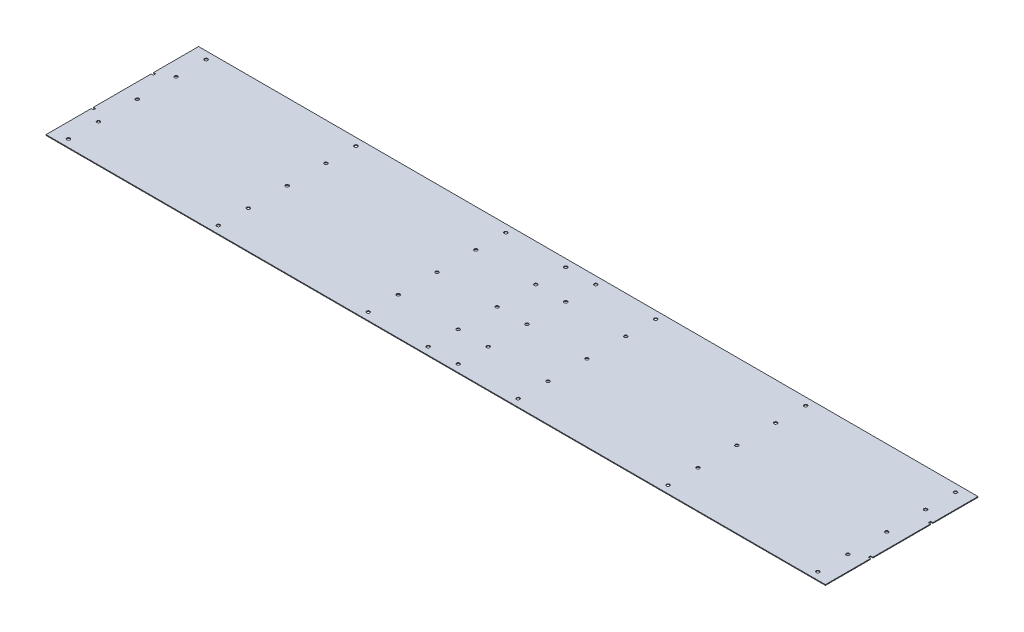
from build123d import *

# Parameters (mm, degrees)
SKETCH1_R           = 2.15
BOSS_EXTRUDE1_DEPTH = 1


with BuildPart() as part:
    # Sketch1 → Boss-Extrude1 (new body)
    with BuildSketch(Plane(origin=(0, 0, 0), x_dir=(1, 0, 0), z_dir=(0, 1, 0))):
        Polygon((-17, -41.5), (-20, -41.5), (-20, -101.8), (1020, -101.8), (1020, -41.5), (1017, -41.5), (1017, -38.5), (1020, -38.5), (1020, 38.5), (1017, 38.5), (1017, 41.5), (1020, 41.5), (1020, 101.8), (-20, 101.8), (-20, 41.5), (-17, 41.5), (-17, 38.5), (-20, 38.5), (-20, -38.5), (-17, -38.5), align=None)
        with Locations((0, -91.8)):
            Circle(SKETCH1_R, mode=Mode.SUBTRACT)
        with Locations((200, -91.8)):
            Circle(SKETCH1_R, mode=Mode.SUBTRACT)
        with Locations((0, -51.8)):
            Circle(SKETCH1_R, mode=Mode.SUBTRACT)
        with Locations((200, -51.8)):
            Circle(SKETCH1_R, mode=Mode.SUBTRACT)
        with Locations((400, -91.8)):
            Circle(SKETCH1_R, mode=Mode.SUBTRACT)
        with Locations((480, -91.8)):
            Circle(SKETCH1_R, mode=Mode.SUBTRACT)
        with Locations((400, -51.8)):
            Circle(SKETCH1_R, mode=Mode.SUBTRACT)
        with Locations((480, -51.8)):
            Circle(SKETCH1_R, mode=Mode.SUBTRACT)
        Circle(SKETCH1_R, mode=Mode.SUBTRACT)
        with Locations((200, 0)):
            Circle(SKETCH1_R, mode=Mode.SUBTRACT)
        with Locations((400, 0)):
            Circle(SKETCH1_R, mode=Mode.SUBTRACT)
        with Locations((480, 0)):
            Circle(SKETCH1_R, mode=Mode.SUBTRACT)
        with Locations((520, -91.8)):
            Circle(SKETCH1_R, mode=Mode.SUBTRACT)
        with Locations((600, -91.8)):
            Circle(SKETCH1_R, mode=Mode.SUBTRACT)
        with Locations((520, -51.8)):
            Circle(SKETCH1_R, mode=Mode.SUBTRACT)
        with Locations((600, -51.8)):
            Circle(SKETCH1_R, mode=Mode.SUBTRACT)
        with Locations((800, -91.8)):
            Circle(SKETCH1_R, mode=Mode.SUBTRACT)
        with Locations((1000, -91.8)):
            Circle(SKETCH1_R, mode=Mode.SUBTRACT)
        with Locations((800, -51.8)):
            Circle(SKETCH1_R, mode=Mode.SUBTRACT)
        with Locations((1000, -51.8)):
            Circle(SKETCH1_R, mode=Mode.SUBTRACT)
        with Locations((520, 0)):
            Circle(SKETCH1_R, mode=Mode.SUBTRACT)
        with Locations((600, 0)):
            Circle(SKETCH1_R, mode=Mode.SUBTRACT)
        with Locations((800, 0)):
            Circle(SKETCH1_R, mode=Mode.SUBTRACT)
        with Locations((1000, 0)):
            Circle(SKETCH1_R, mode=Mode.SUBTRACT)
        with Locations((0, 51.8)):
            Circle(SKETCH1_R, mode=Mode.SUBTRACT)
        with Locations((200, 51.8)):
            Circle(SKETCH1_R, mode=Mode.SUBTRACT)
        with Locations((0, 91.8)):
            Circle(SKETCH1_R, mode=Mode.SUBTRACT)
        with Locations((200, 91.8)):
            Circle(SKETCH1_R, mode=Mode.SUBTRACT)
        with Locations((400, 51.8)):
            Circle(SKETCH1_R, mode=Mode.SUBTRACT)
        with Locations((480, 51.8)):
            Circle(SKETCH1_R, mode=Mode.SUBTRACT)
        with Locations((400, 91.8)):
            Circle(SKETCH1_R, mode=Mode.SUBTRACT)
        with Locations((480, 91.8)):
            Circle(SKETCH1_R, mode=Mode.SUBTRACT)
        with Locations((520, 51.8)):
            Circle(SKETCH1_R, mode=Mode.SUBTRACT)
        with Locations((600, 51.8)):
            Circle(SKETCH1_R, mode=Mode.SUBTRACT)
        with Locations((520, 91.8)):
            Circle(SKETCH1_R, mode=Mode.SUBTRACT)
        with Locations((600, 91.8)):
            Circle(SKETCH1_R, mode=Mode.SUBTRACT)
        with Locations((800, 51.8)):
            Circle(SKETCH1_R, mode=Mode.SUBTRACT)
        with Locations((1000, 51.8)):
            Circle(SKETCH1_R, mode=Mode.SUBTRACT)
        with Locations((800, 91.8)):
            Circle(SKETCH1_R, mode=Mode.SUBTRACT)
        with Locations((1000, 91.8)):
            Circle(SKETCH1_R, mode=Mode.SUBTRACT)
    extrude(amount=BOSS_EXTRUDE1_DEPTH)


solid = part.part
